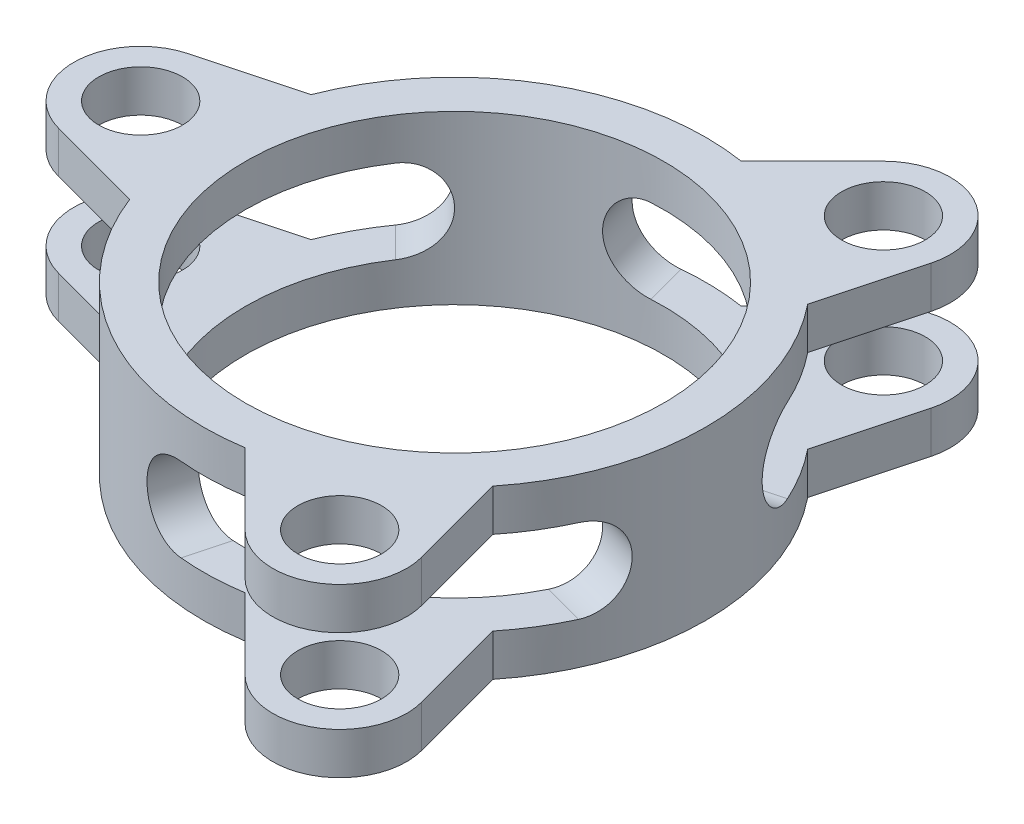
from build123d import *

# Parameters (mm, degrees)
SKETCH1_R           = 30
SKETCH1_R_2         = 25
BOSS_EXTRUDE1_DEPTH = 10
SKETCH3_R           = 5
BOSS_EXTRUDE2_DEPTH = 5
CUT_EXTRUDE1_DEPTH  = 5
FILLET3_R           = 5
FILLET4_R           = 5
FILLET5_R           = 5
FILLET6_R           = 5
FILLET7_R           = 5
FILLET8_R           = 5


with BuildPart() as part:
    # Sketch1 → Boss-Extrude1 (new, symmetric)
    with BuildSketch(Plane(origin=(0, 0, 0), x_dir=(1, 0, 0), z_dir=(0, 1, 0))):
        with Locations(Location((0, 0, 0), (0, 0, 270))):
            Circle(SKETCH1_R)
        with Locations(Location((0, 0, 0), (0, 0, 270))):
            Circle(SKETCH1_R_2, mode=Mode.SUBTRACT)
    extrude(amount=BOSS_EXTRUDE1_DEPTH, both=True)

    # Sketch3 → Boss-Extrude2 (add)
    # profile 1 of 3: a face of its own
    with BuildSketch(Plane(origin=(0, 10, 0), x_dir=(1, 0, 0), z_dir=(0, 1, 0))):
        with BuildLine():
            Line((-39.570552361, 7.72740661), (-27.975291142, 10.83434749))
            ThreePointArc((-27.975291142, 10.83434749), (-30, 0), (-27.975291142, -10.83434749))
            Line((-27.975291142, -10.83434749), (-39.570552361, -7.72740661))
            ThreePointArc((-39.570552361, -7.72740661), (-45.5, 0), (-39.570552361, 7.72740661))
        make_face()
        with Locations(Location((-37.5, 0, 0), (0, 0, 270))):
            Circle(SKETCH3_R, mode=Mode.SUBTRACT)
    # profile 2 of 3: a face of its own
    with BuildSketch(Plane(origin=(0, 10, 0), x_dir=(1, 0, 0), z_dir=(0, 1, 0))):
        with BuildLine():
            Line((26.47740661, 30.405400281), (23.370465731, 18.810139062))
            ThreePointArc((23.370465731, 18.810139062), (15, 25.980762114), (4.604825411, 29.644486552))
            Line((4.604825411, 29.644486552), (13.093145751, 38.132806891))
            ThreePointArc((13.093145751, 38.132806891), (22.75, 39.404155872), (26.47740661, 30.405400281))
        make_face()
        with Locations(Location((18.75, 32.475952642, 0), (0, 0, 270))):
            Circle(SKETCH3_R, mode=Mode.SUBTRACT)
    # profile 3 of 3: a face of its own
    with BuildSketch(Plane(origin=(0, 10, 0), x_dir=(1, 0, 0), z_dir=(0, 1, 0))):
        with BuildLine():
            Line((13.093145751, -38.132806891), (4.604825411, -29.644486552))
            ThreePointArc((4.604825411, -29.644486552), (15, -25.980762114), (23.370465731, -18.810139062))
            Line((23.370465731, -18.810139062), (26.47740661, -30.405400281))
            ThreePointArc((26.47740661, -30.405400281), (22.75, -39.404155872), (13.093145751, -38.132806891))
        make_face()
        with Locations(Location((18.75, -32.475952642, 0), (0, 0, 270))):
            Circle(SKETCH3_R, mode=Mode.SUBTRACT)
    boss_extrude2 = extrude(amount=-BOSS_EXTRUDE2_DEPTH)

    # Mirror1: Boss-Extrude2 across plane
    add(boss_extrude2.mirror(Plane.ZX))

    # Sketch4 → Cut-Extrude1 (cut, symmetric)
    with BuildSketch(Plane(origin=(0, 0, 0), x_dir=(1, 0, 0), z_dir=(0, 1, 0))):
        with BuildLine():
            ThreePointArc((-17.67766953, 17.67766953), (-25, 0), (-17.67766953, -17.67766953))
            Line((-17.67766953, -17.67766953), (-21.213203436, -21.213203436))
            ThreePointArc((-21.213203436, -21.213203436), (-30, 0), (-21.213203436, 21.213203436))
            Line((-21.213203436, 21.213203436), (-17.67766953, 17.67766953))
        make_face()
        with BuildLine():
            Line((24.148145657, -6.470476128), (28.977774789, -7.764571353))
            ThreePointArc((28.977774789, -7.764571353), (15, -25.980762114), (-7.764571353, -28.977774789))
            Line((-7.764571353, -28.977774789), (-6.470476128, -24.148145657))
            ThreePointArc((-6.470476128, -24.148145657), (12.5, -21.650635095), (24.148145657, -6.470476128))
        make_face()
        with BuildLine():
            Line((-6.470476128, 24.148145657), (-7.764571353, 28.977774789))
            ThreePointArc((-7.764571353, 28.977774789), (15, 25.980762114), (28.977774789, 7.764571353))
            Line((28.977774789, 7.764571353), (24.148145657, 6.470476128))
            ThreePointArc((24.148145657, 6.470476128), (12.5, 21.650635095), (-6.470476128, 24.148145657))
        make_face()
    extrude(amount=CUT_EXTRUDE1_DEPTH, both=True, mode=Mode.SUBTRACT)

    # Fillet3
    fillet3_edges = [part.edges().sort_by_distance(p)[0] for p in [
        (-19.445436483, -5, -19.445436483),
        (-19.445436483, 5, -19.445436483),
    ]]
    fillet(fillet3_edges, radius=FILLET3_R - 0.0001)  # a hair under: the kernel refuses the full size

    # Fillet4
    fillet4_edges = [part.edges().sort_by_distance(p)[0] for p in [
        (-19.445436483, 5, 19.445436483),
        (-19.445436483, -5, 19.445436483),
    ]]
    fillet(fillet4_edges, radius=FILLET4_R - 0.0001)  # a hair under: the kernel refuses the full size

    # Fillet5
    fillet5_edges = [part.edges().sort_by_distance(p)[0] for p in [
        (-7.11752374, -5, 26.562960223),
        (-7.11752374, 5, 26.562960223),
    ]]
    fillet(fillet5_edges, radius=FILLET5_R - 0.0001)  # a hair under: the kernel refuses the full size

    # Fillet6
    fillet6_edges = [part.edges().sort_by_distance(p)[0] for p in [
        (26.562960223, 5, 7.11752374),
        (26.562960223, -5, 7.11752374),
    ]]
    fillet(fillet6_edges, radius=FILLET6_R - 0.0001)  # a hair under: the kernel refuses the full size

    # Fillet7
    fillet7_edges = [part.edges().sort_by_distance(p)[0] for p in [
        (26.562960223, -5, -7.11752374),
        (26.562960223, 5, -7.11752374),
    ]]
    fillet(fillet7_edges, radius=FILLET7_R - 0.0001)  # a hair under: the kernel refuses the full size

    # Fillet8
    fillet8_edges = [part.edges().sort_by_distance(p)[0] for p in [
        (-7.11752374, 5, -26.562960223),
        (-7.11752374, -5, -26.562960223),
    ]]
    fillet(fillet8_edges, radius=FILLET8_R - 0.0001)  # a hair under: the kernel refuses the full size


solid = part.part
